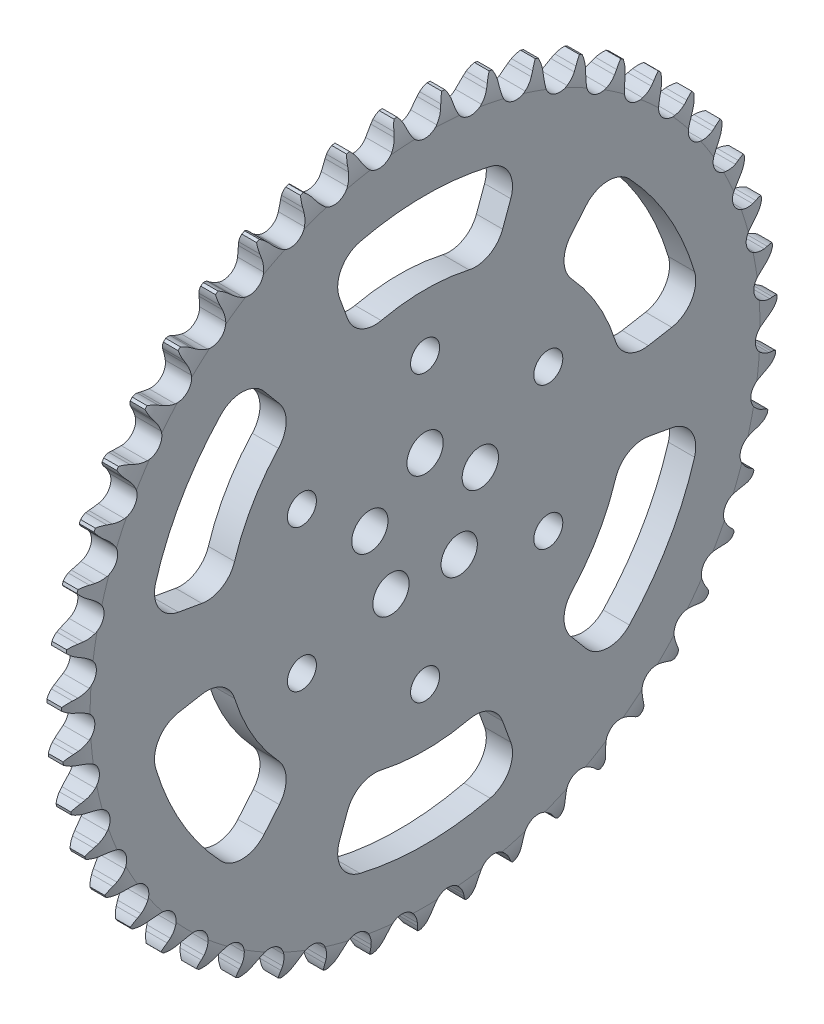
from build123d import *

# Parameters (mm, degrees)
TOOTHCUT_DEPTH           = 140.724253308
TEETHCUTS_COUNT          = 47
TEETHCUTS_ANGLE          = 352.340425532
BORSKE_R                 = 6.35
BORE_DEPTH               = 50.800002
SKETCH1_R                = 15
BOSS_EXTRUDE2_DEPTH      = 7.217664
SKETCH2_R                = 5
CUT_EXTRUDE1_DEPTH       = 140.694933871
SKETCH3_R                = 4
CUT_EXTRUDE2_DEPTH       = 140.694933871
CUT_EXTRUDE3_DEPTH       = 140.694933871
FILLET1_R                = 8
CIRPATTERN3_COUNT        = 6
FILLET1_OF_CIRPATTERN3_R = 8


with BuildPart() as part:
    # BasProSke → Base-Revolve (revolve)
    with BuildSketch(Plane(origin=(0, 0, 0), x_dir=(1, 0, 0), z_dir=(0, 1, 0)), mode=Mode.PRIVATE) as base_revolve_sk:
        with BuildLine():
            Line((0, 0), (0, 92.318060407))
            ThreePointArc((0, 92.318060407), (0.399574234, 95.589241197), (1.5748, 98.668060407))
            Line((1.5748, 98.668060407), (5.642864, 98.668060407))
            ThreePointArc((5.642864, 98.668060407), (6.818089766, 95.589241197), (7.217664, 92.318060407))
            Line((7.217664, 92.318060407), (7.217664, 0))
            Line((7.217664, 0), (0, 0))
        make_face()
    revolve(base_revolve_sk.sketch.rotate(Axis((-10, 0, 0), (1, 0, 0)), 180), axis=Axis((-10, 0, 0), (1, 0, 0)))

    # TooCutSke → ToothCut (cut, through all)
    with BuildSketch(Plane(origin=(0, 0, 0), x_dir=(0, 0, -1), z_dir=(1, 0, 0))):
        with BuildLine():
            Line((4.622337397, 95.380894123), (5.00808281, 96.472136931))
            ThreePointArc((5.00808281, 96.472136931), (7.357755528, 99.578841273), (11.069944144, 100.758768994))
            ThreePointArc((11.069944144, 100.758768994), (0, 101.365049167), (-11.069944144, 100.758768994))
            ThreePointArc((-11.069944144, 100.758768994), (-7.357755528, 99.578841273), (-5.00808281, 96.472136931))
            Line((-5.00808281, 96.472136931), (-4.622337397, 95.380894123))
            ThreePointArc((-4.622337397, 95.380894123), (-4.014942322, 93.995252686), (-3.211549268, 92.713265725))
            ThreePointArc((-3.211549268, 92.713265725), (0, 91.086652069), (3.211549268, 92.713265725))
            ThreePointArc((3.211549268, 92.713265725), (4.014942322, 93.995252686), (4.622337397, 95.380894123))
        make_face()
    toothcut = extrude(amount=TOOTHCUT_DEPTH, mode=Mode.SUBTRACT)

    # TeethCuts: ToothCut ×47 about axis
    teethcuts_axis = Axis((-10, 0, 0), (1, 0, 0))
    for i in range(1, TEETHCUTS_COUNT):
        add(toothcut.rotate(teethcuts_axis, i * TEETHCUTS_ANGLE / (TEETHCUTS_COUNT - 1)), mode=Mode.SUBTRACT)

    # BorSke → Bore (cut, symmetric)
    with BuildSketch(Plane(origin=(0, 0, 0), x_dir=(0, 0, -1), z_dir=(1, 0, 0))):
        with Locations(Location((0, 0, 0), (0, 0, 180))):
            Circle(BORSKE_R)
    extrude(amount=BORE_DEPTH, both=True, mode=Mode.SUBTRACT)

    # Sketch1 → Boss-Extrude2 (add)
    with BuildSketch(Plane(origin=(7.217664, 0, 0), x_dir=(0, 0, -1), z_dir=(1, 0, 0))):
        Circle(SKETCH1_R)
    extrude(amount=-BOSS_EXTRUDE2_DEPTH)

    # Sketch2 → Cut-Extrude1 (cut, through all)
    with BuildSketch(Plane(origin=(7.217664, 0, 0), x_dir=(0, 0, -1), z_dir=(1, 0, 0))):
        with Locations((0, 16)):
            Circle(SKETCH2_R)
        with Locations((15.216904261, 4.94427191)):
            Circle(SKETCH2_R)
        with Locations((9.404564037, -12.94427191)):
            Circle(SKETCH2_R)
        with Locations((-9.404564037, -12.94427191)):
            Circle(SKETCH2_R)
        with Locations((-15.216904261, 4.94427191)):
            Circle(SKETCH2_R)
    extrude(amount=-CUT_EXTRUDE1_DEPTH, mode=Mode.SUBTRACT)

    # Sketch3 → Cut-Extrude2 (cut, through all)
    with BuildSketch(Plane(origin=(7.217664, 0, 0), x_dir=(0, 0, -1), z_dir=(1, 0, 0))):
        with Locations((0, 39.21)):
            Circle(SKETCH3_R)
        with Locations((33.956856082, 19.605)):
            Circle(SKETCH3_R)
        with Locations((33.956856082, -19.605)):
            Circle(SKETCH3_R)
        with Locations((0, -39.21)):
            Circle(SKETCH3_R)
        with Locations((-33.956856082, -19.605)):
            Circle(SKETCH3_R)
        with Locations((-33.956856082, 19.605)):
            Circle(SKETCH3_R)
    extrude(amount=-CUT_EXTRUDE2_DEPTH, mode=Mode.SUBTRACT)

    # Sketch4 → Cut-Extrude3 (cut, through all)
    with BuildSketch(Plane(origin=(7.217664, 0, 0), x_dir=(0, 0, -1), z_dir=(1, 0, 0))):
        with BuildLine():
            Line((-18.811107883, 51.683094143), (-26.506561108, 72.826178111))
            ThreePointArc((-26.506561108, 72.826178111), (0, 77.5), (26.506561108, 72.826178111))
            Line((26.506561108, 72.826178111), (18.811107883, 51.683094143))
            ThreePointArc((18.811107883, 51.683094143), (0, 55), (-18.811107883, 51.683094143))
        make_face()
    cut_extrude3 = extrude(amount=-CUT_EXTRUDE3_DEPTH, mode=Mode.SUBTRACT)

    # Fillet1
    fillet1_edges = [part.edges().sort_by_distance(p)[0] for p in [
        (3.608832, 51.683094143, -18.811107883),
        (3.608832, 51.683094143, 18.811107883),
        (3.608832, 72.826178111, 26.506561108),
        (3.608832, 72.826178111, -26.506561108),
    ]]
    fillet(fillet1_edges, radius=FILLET1_R)

    # CirPattern3: Cut-Extrude3 ×6 about axis
    cirpattern3_axis = Axis((0, 0, 0), (1, 0, 0))
    for i in range(1, CIRPATTERN3_COUNT):
        add(cut_extrude3.rotate(cirpattern3_axis, i * 360 / CIRPATTERN3_COUNT), mode=Mode.SUBTRACT)

    # Fillet1 of CirPattern3
    fillet1_of_cirpattern3_edges = [part.edges().sort_by_distance(p)[0] for p in [
        (3.608832, 42.132444372, 35.353318533),
        (3.608832, 9.550649772, 54.164426416),
        (3.608832, 13.457733769, 76.322600858),
        (3.608832, 59.368444342, 49.816039751),
        (3.608832, -9.550649772, 54.164426416),
        (3.608832, -42.132444372, 35.353318533),
        (3.608832, -59.368444342, 49.816039751),
        (3.608832, -13.457733769, 76.322600858),
        (3.608832, -51.683094143, 18.811107883),
        (3.608832, -51.683094143, -18.811107883),
        (3.608832, -72.826178111, -26.506561108),
        (3.608832, -72.826178111, 26.506561108),
        (3.608832, -42.132444372, -35.353318533),
        (3.608832, -9.550649772, -54.164426416),
        (3.608832, -13.457733769, -76.322600858),
        (3.608832, -59.368444342, -49.816039751),
        (3.608832, 9.550649772, -54.164426416),
        (3.608832, 42.132444372, -35.353318533),
        (3.608832, 59.368444342, -49.816039751),
        (3.608832, 13.457733769, -76.322600858),
    ]]
    fillet(fillet1_of_cirpattern3_edges, radius=FILLET1_OF_CIRPATTERN3_R)


solid = part.part
